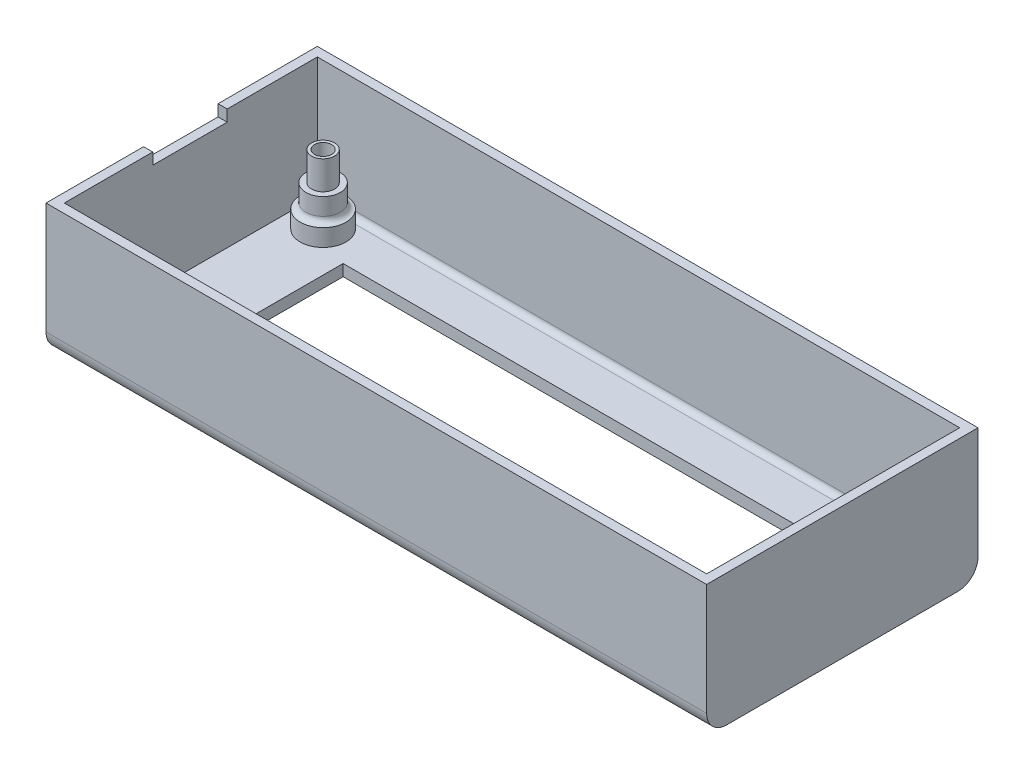
from build123d import *

# Parameters (mm, degrees)
SKETCH_1_W          = 115.4
SKETCH_1_H          = 47.4
EXTRUDE_1_DEPTH     = 2
SKETCH_2_W          = 115.4
SKETCH_2_H          = 47.4
SKETCH_2_W_2        = 112.2
SKETCH_2_H_2        = 44.2
EXTRUDE_2_DEPTH     = 21
CUT_EXTRUDE_1_REACH = 67.818
SKETCH_3_W          = 87.2
SKETCH_3_H          = 29.7
SKETCH_4_W          = 10
SKETCH_4_H          = 7
CUT_EXTRUDE_2_DEPTH = 1.3
SKETCH_5_R          = 3
EXTRUDE_3_DEPTH     = 7
SKETCH_6_R          = 2
EXTRUDE_4_DEPTH     = 5
CUT_EXTRUDE_3_REACH = 65.929
SKETCH_7_R          = 1.5
SKETCH_8_R          = 4
EXTRUDE_8_DEPTH     = 3
FILLET_1_R          = 1
SKETCH_9_R          = 3
CUT_EXTRUDE_4_DEPTH = 3
CUT_EXTRUDE_5_REACH = 66.923
SKETCH_10_R         = 1.5
SKETCH_11_W         = 1.6
SKETCH_11_H         = 13
CUT_EXTRUDE_6_DEPTH = 2
FILLET_2_R          = 3.5
FILLET_3_R          = 1


# Some blends are built 0.0001 mm under size
with BuildPart() as part:
    # 草图1 → 凸台-拉伸1 (new body)
    with BuildSketch(Plane(origin=(0, 0, 0), x_dir=(1, 0, 0), z_dir=(0, 1, 0))):
        Rectangle(SKETCH_1_W, SKETCH_1_H)
    extrude(amount=EXTRUDE_1_DEPTH)

    # 草图2 → 凸台-拉伸2 (add)
    with BuildSketch(Plane(origin=(0, 2, 0), x_dir=(1, 0, 0), z_dir=(0, 1, 0))):
        Rectangle(SKETCH_2_W, SKETCH_2_H)
        Rectangle(SKETCH_2_W_2, SKETCH_2_H_2, mode=Mode.SUBTRACT)
    extrude(amount=EXTRUDE_2_DEPTH)

    # 草图3 → 切除-拉伸1 (cut, up to next)
    with BuildSketch(Plane(origin=(0, 2, 0), x_dir=(1, 0, 0), z_dir=(0, 1, 0)), mode=Mode.PRIVATE) as cut_extrude_1_sk1:
        with Locations((0, -0.75)):
            Rectangle(SKETCH_3_W, SKETCH_3_H)
    cut_extrude_1_tool1 = extrude(cut_extrude_1_sk1.sketch, amount=-CUT_EXTRUDE_1_REACH, mode=Mode.PRIVATE) & part.part
    add(cut_extrude_1_tool1.solids().sort_by_distance((0, 2, 0.75))[0], mode=Mode.SUBTRACT)

    # 草图4 → 切除-拉伸2 (cut)
    with BuildSketch(Plane(origin=(0, 2, 0), x_dir=(1, 0, 0), z_dir=(0, 1, 0))):
        with Locations((48.6, 9.6)):
            Rectangle(SKETCH_4_W, SKETCH_4_H)
    extrude(amount=-CUT_EXTRUDE_2_DEPTH, mode=Mode.SUBTRACT)

    # 草图5 → 凸台-拉伸3 (add)
    with BuildSketch(Plane(origin=(0, 2, 0), x_dir=(1, 0, 0), z_dir=(0, 1, 0))):
        with Locations(Location((50.6, -17.6, 0), (0, 0, 270))):
            Circle(SKETCH_5_R)
        with Locations(Location((50.6, 17.6, 0), (0, 0, 270))):
            Circle(SKETCH_5_R)
        with Locations(Location((-50.6, -17.6, 0), (0, 0, 270))):
            Circle(SKETCH_5_R)
        with Locations(Location((-50.6, 17.6, 0), (0, 0, 270))):
            Circle(SKETCH_5_R)
    extrude(amount=EXTRUDE_3_DEPTH)

    # 草图6 → 凸台-拉伸4 (add)
    with BuildSketch(Plane(origin=(0, 9, 0), x_dir=(1, 0, 0), z_dir=(0, 1, 0))):
        with Locations(Location((50.6, -17.6, 0), (0, 0, 270))):
            Circle(SKETCH_6_R)
        with Locations(Location((50.6, 17.6, 0), (0, 0, 270))):
            Circle(SKETCH_6_R)
        with Locations(Location((-50.6, -17.6, 0), (0, 0, 270))):
            Circle(SKETCH_6_R)
        with Locations(Location((-50.6, 17.6, 0), (0, 0, 270))):
            Circle(SKETCH_6_R)
    extrude(amount=EXTRUDE_4_DEPTH)

    # 草图7 → 切除-拉伸3 (cut, up to next)
    with BuildSketch(Plane(origin=(0, 14, 0), x_dir=(1, 0, 0), z_dir=(0, 1, 0)), mode=Mode.PRIVATE) as cut_extrude_3_sk1:
        with Locations(Location((50.6, -17.6, 0), (0, 0, 270))):
            Circle(SKETCH_7_R)
    cut_extrude_3_tool1 = extrude(cut_extrude_3_sk1.sketch, amount=-CUT_EXTRUDE_3_REACH, mode=Mode.PRIVATE) & part.part
    # 草图7 → 切除-拉伸3 (cut, up to next)
    with BuildSketch(Plane(origin=(0, 14, 0), x_dir=(1, 0, 0), z_dir=(0, 1, 0)), mode=Mode.PRIVATE) as cut_extrude_3_sk2:
        with Locations(Location((-50.6, -17.6, 0), (0, 0, 270))):
            Circle(SKETCH_7_R)
    cut_extrude_3_tool2 = extrude(cut_extrude_3_sk2.sketch, amount=-CUT_EXTRUDE_3_REACH, mode=Mode.PRIVATE) & part.part
    # 草图7 → 切除-拉伸3 (cut, up to next)
    with BuildSketch(Plane(origin=(0, 14, 0), x_dir=(1, 0, 0), z_dir=(0, 1, 0)), mode=Mode.PRIVATE) as cut_extrude_3_sk3:
        with Locations(Location((50.6, 17.6, 0), (0, 0, 270))):
            Circle(SKETCH_7_R)
    cut_extrude_3_tool3 = extrude(cut_extrude_3_sk3.sketch, amount=-CUT_EXTRUDE_3_REACH, mode=Mode.PRIVATE) & part.part
    # 草图7 → 切除-拉伸3 (cut, up to next)
    with BuildSketch(Plane(origin=(0, 14, 0), x_dir=(1, 0, 0), z_dir=(0, 1, 0)), mode=Mode.PRIVATE) as cut_extrude_3_sk4:
        with Locations(Location((-50.6, 17.6, 0), (0, 0, 270))):
            Circle(SKETCH_7_R)
    cut_extrude_3_tool4 = extrude(cut_extrude_3_sk4.sketch, amount=-CUT_EXTRUDE_3_REACH, mode=Mode.PRIVATE) & part.part
    add(cut_extrude_3_tool1.solids().sort_by_distance((50.6, 14, 17.6))[0], mode=Mode.SUBTRACT)
    add(cut_extrude_3_tool2.solids().sort_by_distance((-50.6, 14, 17.6))[0], mode=Mode.SUBTRACT)
    add(cut_extrude_3_tool3.solids().sort_by_distance((50.6, 14, -17.6))[0], mode=Mode.SUBTRACT)
    add(cut_extrude_3_tool4.solids().sort_by_distance((-50.6, 14, -17.6))[0], mode=Mode.SUBTRACT)

    # 草图8 → 凸台-拉伸8 (add)
    with BuildSketch(Plane(origin=(0, 2, 0), x_dir=(1, 0, 0), z_dir=(0, 1, 0))):
        with Locations(Location((50.6, -17.6, 0), (0, 0, 270))):
            Circle(SKETCH_8_R)
        with Locations(Location((50.6, 17.6, 0), (0, 0, 270))):
            Circle(SKETCH_8_R)
        with Locations(Location((-50.6, -17.6, 0), (0, 0, 270))):
            Circle(SKETCH_8_R)
        with Locations(Location((-50.6, 17.6, 0), (0, 0, 270))):
            Circle(SKETCH_8_R)
    extrude(amount=EXTRUDE_8_DEPTH)

    # 圆角1
    fillet_1_edges = [part.edges().sort_by_distance(p)[0] for p in [
        (50.6, 5, 14.6),
        (50.6, 5, -20.6),
        (-50.6, 5, 14.6),
        (-50.6, 5, -20.6),
    ]]
    fillet(fillet_1_edges, radius=FILLET_1_R - 0.0001)  # a hair under: the kernel refuses the full size

    # 草图9 → 切除-拉伸4 (cut)
    with BuildSketch(Plane.XZ):
        with Locations(Location((-50.6, 17.6, 0), (0, 0, 90))):
            Circle(SKETCH_9_R)
        with Locations(Location((50.6, 17.6, 0), (0, 0, 90))):
            Circle(SKETCH_9_R)
        with Locations(Location((50.6, -17.6, 0), (0, 0, 90))):
            Circle(SKETCH_9_R)
        with Locations(Location((-50.6, -17.6, 0), (0, 0, 90))):
            Circle(SKETCH_9_R)
    extrude(amount=-CUT_EXTRUDE_4_DEPTH, mode=Mode.SUBTRACT)

    # 草图10 → 切除-拉伸5 (cut, up to next)
    with BuildSketch(Plane(origin=(0, 5, 0), x_dir=(1, 0, 0), z_dir=(0, 1, 0)), mode=Mode.PRIVATE) as cut_extrude_5_sk1:
        with Locations(Location((50.6, -17.6, 0), (0, 0, 270))):
            Circle(SKETCH_10_R)
    cut_extrude_5_tool1 = extrude(cut_extrude_5_sk1.sketch, amount=-CUT_EXTRUDE_5_REACH, mode=Mode.PRIVATE) & part.part
    # 草图10 → 切除-拉伸5 (cut, up to next)
    with BuildSketch(Plane(origin=(0, 5, 0), x_dir=(1, 0, 0), z_dir=(0, 1, 0)), mode=Mode.PRIVATE) as cut_extrude_5_sk2:
        with Locations(Location((50.6, 17.6, 0), (0, 0, 270))):
            Circle(SKETCH_10_R)
    cut_extrude_5_tool2 = extrude(cut_extrude_5_sk2.sketch, amount=-CUT_EXTRUDE_5_REACH, mode=Mode.PRIVATE) & part.part
    # 草图10 → 切除-拉伸5 (cut, up to next)
    with BuildSketch(Plane(origin=(0, 5, 0), x_dir=(1, 0, 0), z_dir=(0, 1, 0)), mode=Mode.PRIVATE) as cut_extrude_5_sk3:
        with Locations(Location((-50.6, 17.6, 0), (0, 0, 270))):
            Circle(SKETCH_10_R)
    cut_extrude_5_tool3 = extrude(cut_extrude_5_sk3.sketch, amount=-CUT_EXTRUDE_5_REACH, mode=Mode.PRIVATE) & part.part
    # 草图10 → 切除-拉伸5 (cut, up to next)
    with BuildSketch(Plane(origin=(0, 5, 0), x_dir=(1, 0, 0), z_dir=(0, 1, 0)), mode=Mode.PRIVATE) as cut_extrude_5_sk4:
        with Locations(Location((-50.6, -17.6, 0), (0, 0, 270))):
            Circle(SKETCH_10_R)
    cut_extrude_5_tool4 = extrude(cut_extrude_5_sk4.sketch, amount=-CUT_EXTRUDE_5_REACH, mode=Mode.PRIVATE) & part.part
    add(cut_extrude_5_tool1.solids().sort_by_distance((50.6, 5, 17.6))[0], mode=Mode.SUBTRACT)
    add(cut_extrude_5_tool2.solids().sort_by_distance((50.6, 5, -17.6))[0], mode=Mode.SUBTRACT)
    add(cut_extrude_5_tool3.solids().sort_by_distance((-50.6, 5, -17.6))[0], mode=Mode.SUBTRACT)
    add(cut_extrude_5_tool4.solids().sort_by_distance((-50.6, 5, 17.6))[0], mode=Mode.SUBTRACT)

    # 草图11 → 切除-拉伸6 (cut)
    with BuildSketch(Plane(origin=(0, 23, 0), x_dir=(1, 0, 0), z_dir=(0, 1, 0))):
        with Locations((-56.9, -0.15)):
            Rectangle(SKETCH_11_W, SKETCH_11_H)
    extrude(amount=-CUT_EXTRUDE_6_DEPTH, mode=Mode.SUBTRACT)

    # 圆角2
    # the kernel refuses this fillet: 3.5 mm, written as the material it takes off along each edge
    with BuildSketch(Plane(origin=(66.45, 0, 23.7), x_dir=(0, 0, -1), z_dir=(-1, 0, 0)), Plane(origin=(-66.45, 0, -23.7), x_dir=(0, 0, 1), z_dir=(1, 0, 0))) as fillet_2_piece_1:
        with BuildLine():
            CenterArc((FILLET_2_R, -FILLET_2_R), FILLET_2_R, 90, 90)
            Line((0, -FILLET_2_R), (0, 0))
            Line((0, 0), (FILLET_2_R, 0))
        make_face()
    extrude(amount=132.9, mode=Mode.SUBTRACT)

    # 圆角3
    # the kernel refuses this fillet: 1 mm, written as the material it adds along each edge
    with BuildSketch(Plane(origin=(-58.6, 2, 22.1), x_dir=(0, 0, -1), z_dir=(1, 0, 0))) as fillet_3_piece_1_section:
        with BuildLine():
            CenterArc((FILLET_3_R, FILLET_3_R), FILLET_3_R, 180, 90)
            Line((0, FILLET_3_R), (0, 0))
            Line((0, 0), (FILLET_3_R, 0))
        make_face()
    fillet_3_piece_1 = extrude(amount=117.2, mode=Mode.PRIVATE)
    fillet_3_piece_1 = split(fillet_3_piece_1, bisect_by=Plane(origin=(-57.7, 2.223988989, 21.878062935), z_dir=(1, 0, 0)), keep=Keep.TOP, mode=Mode.PRIVATE)
    fillet_3_piece_1 = split(fillet_3_piece_1, bisect_by=Plane(origin=(57.7, 2.223988989, 21.878062935), z_dir=(-1, 0, 0)), keep=Keep.TOP, mode=Mode.PRIVATE)
    add(fillet_3_piece_1)
    with BuildSketch(Plane(origin=(58.6, 2, -22.1), x_dir=(0, 0, 1), z_dir=(-1, 0, 0))) as fillet_3_piece_2_section:
        with BuildLine():
            CenterArc((FILLET_3_R, FILLET_3_R), FILLET_3_R, 180, 90)
            Line((0, FILLET_3_R), (0, 0))
            Line((0, 0), (FILLET_3_R, 0))
        make_face()
    fillet_3_piece_2 = extrude(amount=117.2, mode=Mode.PRIVATE)
    fillet_3_piece_2 = split(fillet_3_piece_2, bisect_by=Plane(origin=(-57.7, 2.223988985, -21.878062921), z_dir=(1, 0, 0)), keep=Keep.TOP, mode=Mode.PRIVATE)
    fillet_3_piece_2 = split(fillet_3_piece_2, bisect_by=Plane(origin=(57.7, 2.223988985, -21.878062921), z_dir=(-1, 0, 0)), keep=Keep.TOP, mode=Mode.PRIVATE)
    add(fillet_3_piece_2)


solid = part.part
